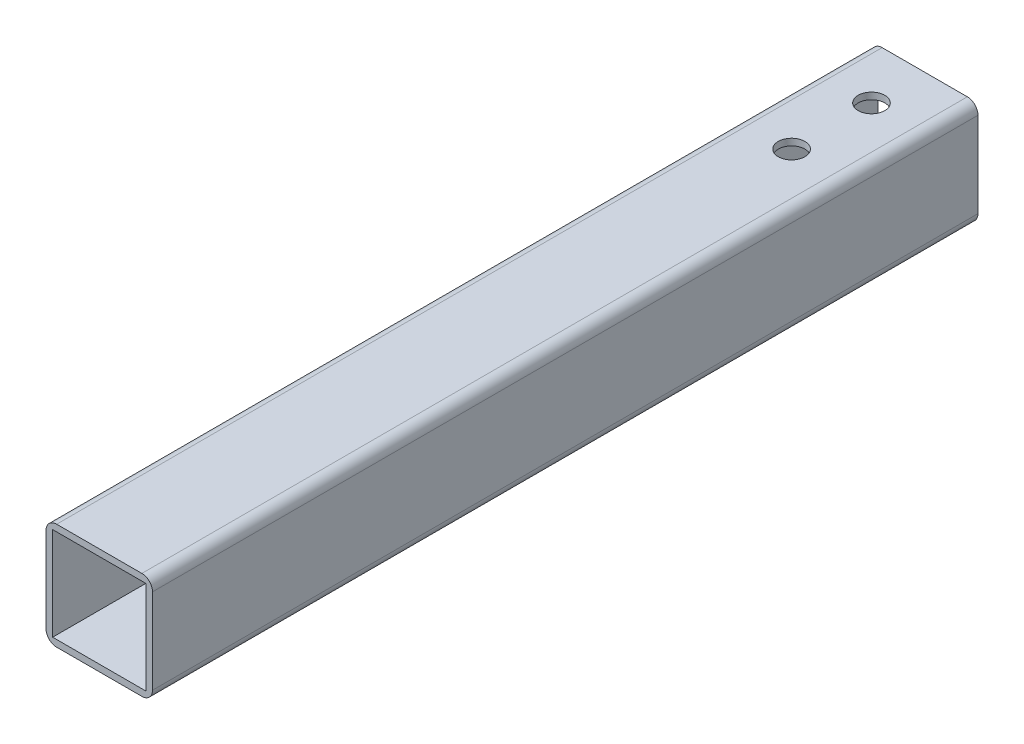
from build123d import *

# Parameters (mm, degrees)
SKETCH1_W           = 25.4
SKETCH1_H           = 25.4
SKETCH1_W_2         = 22.225
SKETCH1_H_2         = 22.225
BOSS_EXTRUDE1_DEPTH = 196.85
FILLET1_R           = 2.54
SKETCH2_R           = 3.175
CUT_EXTRUDE1_DEPTH  = 200.959021542


with BuildPart() as part:
    # Sketch1 → Boss-Extrude1 (new body)
    with BuildSketch(Plane.XY):
        with Locations((-11.559591837, -1.275183673)):
            Rectangle(SKETCH1_W, SKETCH1_H)
        with Locations((-11.559591837, -1.275183673)):
            Rectangle(SKETCH1_W_2, SKETCH1_H_2, mode=Mode.SUBTRACT)
    extrude(amount=BOSS_EXTRUDE1_DEPTH)

    # Fillet1
    fillet1_edges = [part.edges().sort_by_distance(p)[0] for p in [
        (1.140408163, -13.975183673, 98.425),
        (-24.259591837, -13.975183673, 98.425),
        (-24.259591837, 11.424816327, 98.425),
        (1.140408163, 11.424816327, 98.425),
    ]]
    fillet(fillet1_edges, radius=FILLET1_R)

    # Sketch2 → Cut-Extrude1 (cut, through all)
    with BuildSketch(Plane(origin=(0, 11.424816327, 0), x_dir=(1, 0, 0), z_dir=(0, 1, 0))):
        with Locations((-11.559591837, -12.7)):
            Circle(SKETCH2_R)
        with Locations((-11.559591837, -31.75)):
            Circle(SKETCH2_R)
    extrude(amount=-CUT_EXTRUDE1_DEPTH, mode=Mode.SUBTRACT)


solid = part.part
